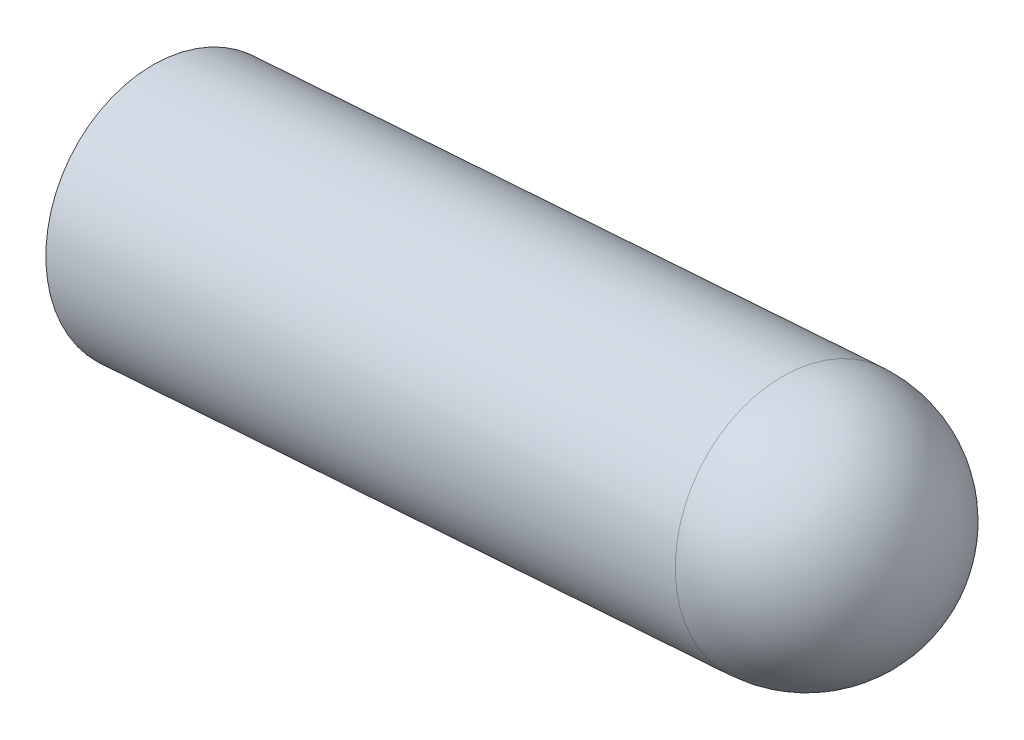
from build123d import *

# Parameters (mm, degrees)
SKETCH1_R           = 15
BOSS_EXTRUDE1_DEPTH = 100
FILLET1_R           = 15
SKALA1_SCALE        = 0.9168


# Read off the part's stored shape, not the designer's step: Bill Native-21-surface1
with BuildPart() as part:
    # Sketch1 → Boss-Extrude1 (new body)
    with BuildSketch(Plane(origin=(-117.976475724, -16.532382314, -8.744573294), x_dir=(-0.07249877007655836, -0.010159460831791603, 0.9973167569498639), z_dir=(-0.9876663912776456, -0.13840452750393126, -0.07320714655692012))):
        with Locations(Location((-65.534620891, -208.354190219, 0), (0, 0, 270))):
            Circle(SKETCH1_R)
    extrude(amount=-BOSS_EXTRUDE1_DEPTH)

    # Fillet1
    fillet1_edges = [part.edges().sort_by_distance(p)[0] for p in [
        (12.37443787, -193.509364491, -66.782634214),
    ]]
    fillet(fillet1_edges, radius=FILLET1_R)


with BuildPart() as part_1:
    # Skala1: scaled about (-37.331416125, -215.62135168, -70.621193148)
    add(part.part.scale(SKALA1_SCALE).moved(Location((-3.105973822, -17.93969646, -5.87568327))))


solid = part_1.part
